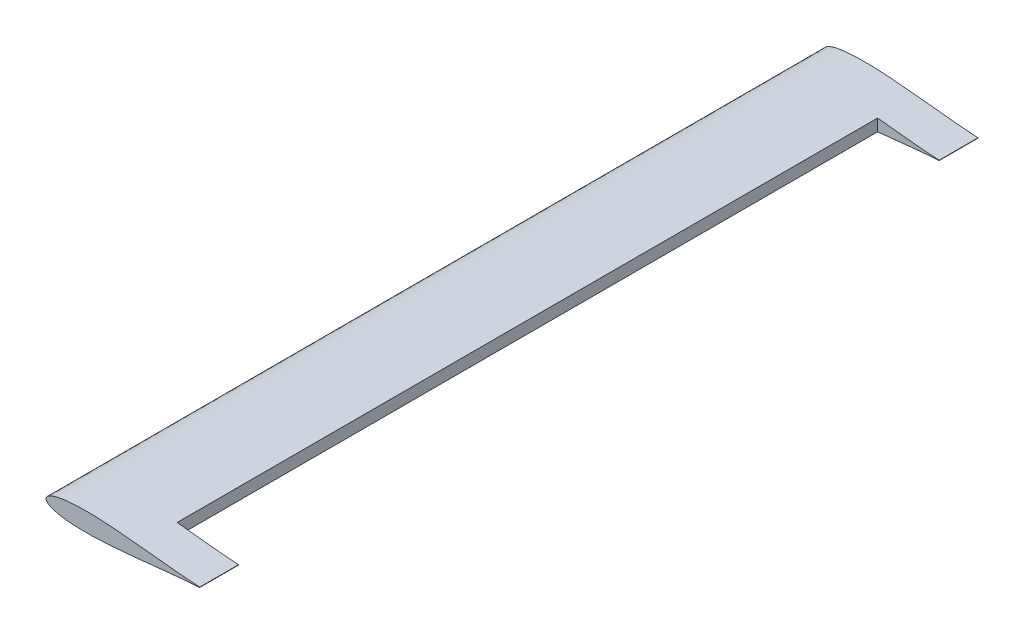
from build123d import *

# Parameters (mm, degrees)
BOSS_EXTRUDE4_DEPTH     = 609.6
CUT_EXTRUDE1_DEPTH      = 622.415849004
CUT_EXTRUDE1_DEPTH_BACK = 622.415849004


with BuildPart() as part:
    # Sketch2 → Boss-Extrude4 (new body)
    with BuildSketch(Plane.XY):
        with BuildLine():
            Line((120.380960043, 0.131910968), (120.380960043, -0.13191095))
            add(Edge.make_bspline(
                [(120.380960043, 0.131910968), (119.946341591, 0.152711182), (118.879825678, 0.207805593), (117.085778754, 0.313677955), (114.917831353, 0.458373703), (112.492651454, 0.638201877), (109.822798753, 0.85371931), (106.921074515, 1.105960198), (103.801681225, 1.393960866), (100.47971538, 1.715903258), (96.971509885, 2.06983989), (93.294019085, 2.451783389), (89.46526698, 2.85749965), (85.503826568, 3.28175384), (81.429064058, 3.718670433), (77.260785731, 4.161966443), (73.019254019, 4.604126338), (68.725181462, 5.03833015), (64.399395462, 5.456362411), (60.063068942, 5.851187181), (55.737197625, 6.214504538), (51.442917043, 6.539202929), (47.201068222, 6.818142459), (43.032378562, 7.044765483), (38.957075624, 7.213123875), (34.99505353, 7.318061293), (31.165536986, 7.354994119), (27.487176119, 7.320854727), (23.977851472, 7.213318692), (20.654583842, 7.030920877), (17.533565736, 6.773866125), (14.629816575, 6.443235187), (11.957394826, 6.041513529), (9.529072463, 5.571825351), (7.356345225, 5.038900712), (5.449154243, 4.448412935), (3.815756487, 3.806735364), (2.462434378, 3.120688392), (1.392845645, 2.396403236), (0.609563184, 1.636816588), (0.117367124, 0.838378891), (-0.055284763, 3e-09), (0.117367124, -0.838378885), (0.609563184, -1.636816583), (1.392845646, -2.396403226), (2.462434375, -3.120688405), (3.815756504, -3.806735267), (5.449154164, -4.44841335), (7.35634558, -5.03889881), (9.529110457, -5.571843411), (11.957441548, -6.041483938), (14.629855539, -6.443250824), (17.533566272, -6.773862839), (20.654583684, -7.030921839), (23.977851518, -7.213318406), (27.487176105, -7.320854803), (31.165536989, -7.354994091), (34.995053529, -7.318061295), (38.957075624, -7.213123869), (43.032378562, -7.044765479), (47.201068221, -6.818142456), (51.442917042, -6.539202923), (55.737197626, -6.214504544), (60.063068938, -5.851187144), (64.399395475, -5.456362534), (68.725181412, -5.038329681), (73.019254201, -4.604128053), (77.260826096, -4.161955886), (81.429107504, -3.718688804), (85.503866958, -3.281743582), (89.46526714, -2.857501142), (93.294019045, -2.45178302), (96.971509892, -2.069839946), (100.479715387, -1.715903365), (103.80168119, -1.393960421), (106.921074635, -1.105961717), (109.82283955, -0.853710658), (112.492693973, -0.638215275), (114.917872344, -0.458367158), (117.085778817, -0.313678794), (118.879825669, -0.207805471), (119.946341589, -0.152711137), (120.380960043, -0.13191095)],
                knots=[0.016066336, 0.016066336, 0.016066336, 0.016066336, 0.021198496, 0.028708349, 0.037278223, 0.046867658, 0.057430489, 0.068916541, 0.081270768, 0.094432341, 0.108338211, 0.122918813, 0.138103257, 0.15381535, 0.169977616, 0.186508903, 0.203327313, 0.220348626, 0.237487597, 0.254659894, 0.271779428, 0.288762762, 0.305526624, 0.321990034, 0.338073446, 0.353702279, 0.368802604, 0.383306141, 0.397148829, 0.410269485, 0.422614248, 0.43413286, 0.444782857, 0.454526749, 0.463337037, 0.471194285, 0.478091852, 0.484041802, 0.489081613, 0.493295092, 0.496841712, 0.500000002, 0.503158291, 0.506704912, 0.510918391, 0.515958202, 0.521908151, 0.528805719, 0.536662967, 0.545473255, 0.555217627, 0.56586714, 0.577385752, 0.589730516, 0.602851171, 0.61669386, 0.631197396, 0.646297721, 0.661926555, 0.678009966, 0.694473376, 0.711237238, 0.728220572, 0.745340106, 0.762512403, 0.779651374, 0.796672688, 0.813491097, 0.830022871, 0.84618465, 0.861896743, 0.877081188, 0.891661789, 0.90556766, 0.918729232, 0.93108346, 0.942569511, 0.953132831, 0.962721777, 0.971291651, 0.978801504, 0.983933664, 0.983933664, 0.983933664, 0.983933664], degree=3))
        make_face()
    extrude(amount=BOSS_EXTRUDE4_DEPTH)

    # Sketch4 → Cut-Extrude1 (cut, two sides: drawn at the far end of the back side and taken through both)
    with BuildSketch(Plane(origin=(0, 0, 0), x_dir=(1, 0, 0), z_dir=(0, 1, 0)).offset(-CUT_EXTRUDE1_DEPTH_BACK)):
        Polygon((72.232720043, -304.8), (72.232720043, -579.12), (171.569247089, -579.12), (171.569247089, -30.48), (72.232720043, -30.48), align=None)
    extrude(amount=CUT_EXTRUDE1_DEPTH + CUT_EXTRUDE1_DEPTH_BACK, mode=Mode.SUBTRACT)


solid = part.part
